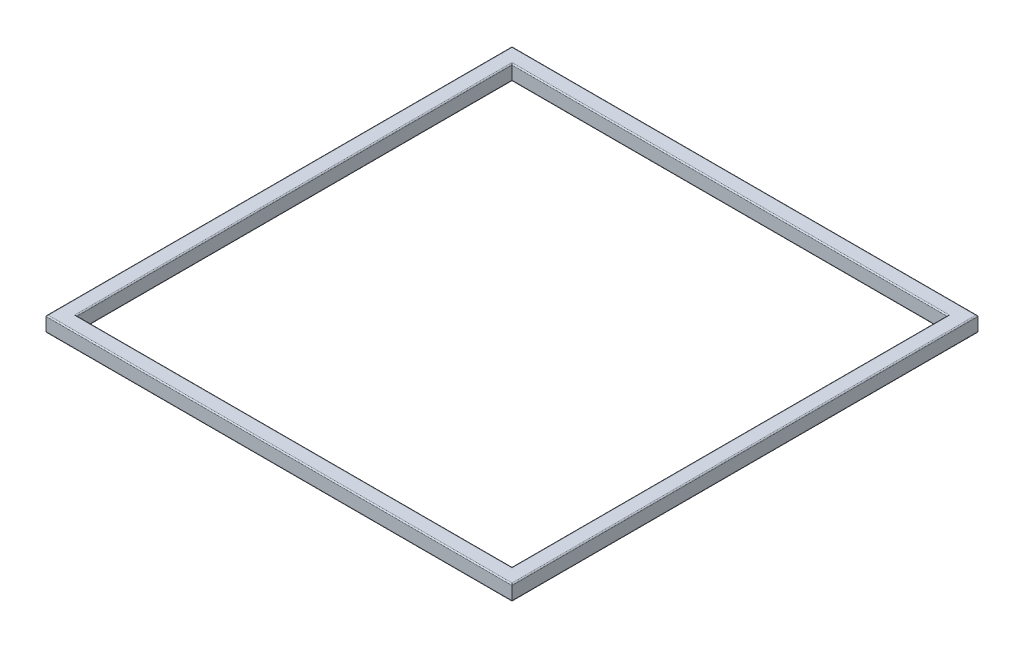
from build123d import *

# Parameters (mm, degrees)
SKETCH1_W           = 1220
SKETCH1_H           = 1220
SKETCH1_W_2         = 1140
SKETCH1_H_2         = 1140
BOSS_EXTRUDE1_DEPTH = 40
SHELL1_START        = 2
SHELL1_OUTLINE_W    = 1216
SHELL1_OUTLINE_H    = 1216
SHELL1_OUTLINE_W_2  = 1144
SHELL1_OUTLINE_H_2  = 1144
SHELL1_DEPTH        = 36
FILLET1_R           = 3


# Read off the part's stored shape, not the designer's step: Shell1
with BuildPart() as part:
    # Sketch1 → Boss-Extrude1 (new body)
    with BuildSketch(Plane(origin=(0, 0, 0), x_dir=(1, 0, 0), z_dir=(0, 1, 0))):
        Rectangle(SKETCH1_W, SKETCH1_H)
        Rectangle(SKETCH1_W_2, SKETCH1_H_2, mode=Mode.SUBTRACT)
    extrude(amount=BOSS_EXTRUDE1_DEPTH)

    # Shell1 outline → Shell1 (cut)
    with BuildSketch(Plane(origin=(0, 0, 0), x_dir=(1, 0, 0), z_dir=(0, 1, 0)).offset(SHELL1_START)):
        Rectangle(SHELL1_OUTLINE_W, SHELL1_OUTLINE_H)
        Rectangle(SHELL1_OUTLINE_W_2, SHELL1_OUTLINE_H_2, mode=Mode.SUBTRACT)
    extrude(amount=SHELL1_DEPTH, mode=Mode.SUBTRACT)

    # Fillet1
    fillet1_edges = [part.edges().sort_by_distance(p)[0] for p in [
        (-610, 40, 0),
        (0, 40, 610),
        (570, 0, 0),
        (0, 0, -570),
        (-570, 0, 0),
        (0, 0, 570),
        (570, 40, 0),
        (0, 40, -570),
        (-570, 40, 0),
        (0, 40, 570),
        (610, 40, 0),
        (0, 0, 610),
        (-610, 0, 0),
        (0, 0, -610),
        (610, 0, 0),
        (0, 40, -610),
    ]]
    fillet(fillet1_edges, radius=FILLET1_R)


solid = part.part
